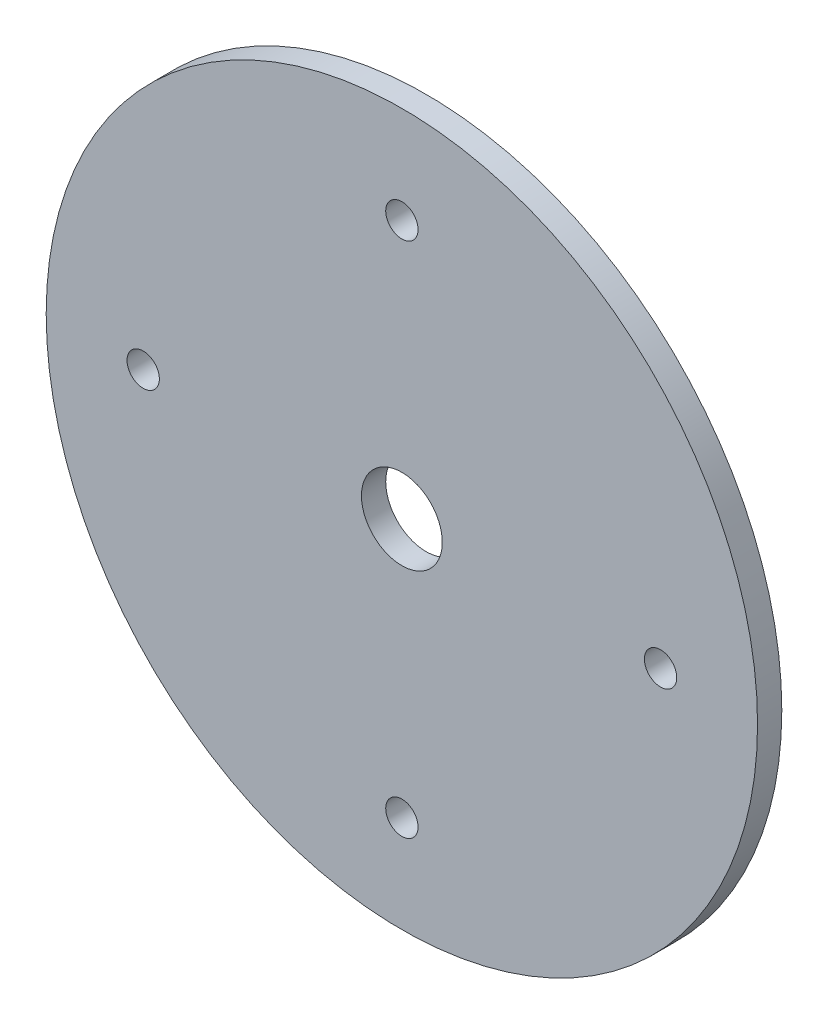
from build123d import *

# Parameters (mm, degrees)
EXTRUDE_1_DEPTH     = 1.5
SKETCH_3_R          = 22
EXTRUDE_2_DEPTH     = 1.5
SKETCH_4_R          = 35.070526428
CUT_EXTRUDE_1_DEPTH = 1.5
SKETCH_5_R          = 1
CUT_EXTRUDE_2_DEPTH = 1.5
SKETCH_6_R          = 2.5
CUT_EXTRUDE_3_DEPTH = 1.5


with BuildPart() as part:
    # 草图2 → 凸台-拉伸1 (new body)
    with BuildSketch(Plane.XY):
        with BuildLine():
            Line((-6, -20.3), (6, -20.3))
            Line((6, -20.3), (7.479773249, -16.152182272))
            ThreePointArc((7.479773249, -16.152182272), (0, 17.8), (-7.479773249, -16.152182272))
            Line((-7.479773249, -16.152182272), (-6, -20.3))
        make_face()
    extrude(amount=EXTRUDE_1_DEPTH)

    # 草图3 → 凸台-拉伸2 (add)
    with BuildSketch(Plane.XY.offset(1.5)):
        Circle(SKETCH_3_R)
    extrude(amount=EXTRUDE_2_DEPTH)

    # 草图4 → 切除-拉伸1 (cut)
    with BuildSketch(Plane(origin=(0, 0, 0), x_dir=(-1, 0, 0), z_dir=(0, 0, -1))):
        Circle(SKETCH_4_R)
    extrude(amount=-CUT_EXTRUDE_1_DEPTH, mode=Mode.SUBTRACT)

    # 草图5 → 切除-拉伸2 (cut)
    with BuildSketch(Plane(origin=(0, 0, 1.5), x_dir=(-1, 0, 0), z_dir=(0, 0, -1))):
        with Locations((0, 16)):
            Circle(SKETCH_5_R)
        with Locations((-16, 0)):
            Circle(SKETCH_5_R)
        with Locations((0, -16)):
            Circle(SKETCH_5_R)
        with Locations((16, 0)):
            Circle(SKETCH_5_R)
    extrude(amount=-CUT_EXTRUDE_2_DEPTH, mode=Mode.SUBTRACT)

    # 草图6 → 切除-拉伸3 (cut)
    with BuildSketch(Plane(origin=(0, 0, 1.5), x_dir=(-1, 0, 0), z_dir=(0, 0, -1))):
        Circle(SKETCH_6_R)
    extrude(amount=-CUT_EXTRUDE_3_DEPTH, mode=Mode.SUBTRACT)


solid = part.part
